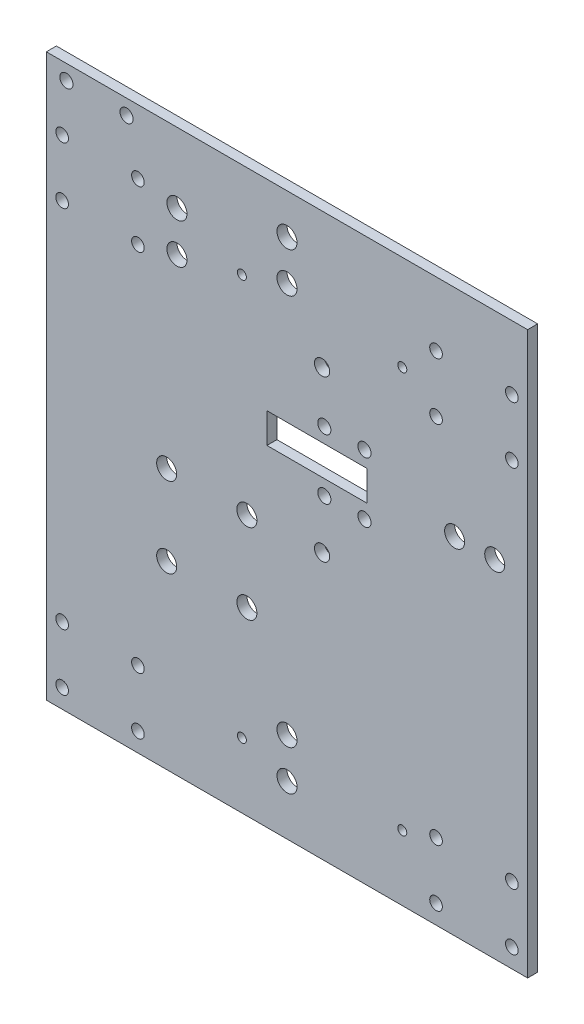
from build123d import *

# Parameters (mm, degrees)
SKETCH1_W           = 152.4
SKETCH1_H           = 177.8
SKETCH1_R           = 3.175
SKETCH1_R_2         = 2.0828
SKETCH1_R_3         = 2
SKETCH1_R_4         = 2.413
SKETCH1_R_5         = 1.4224
SKETCH1_W_2         = 31.75
SKETCH1_H_2         = 9.525
BOSS_EXTRUDE1_DEPTH = 3.175


with BuildPart() as part:
    # Sketch1 → Boss-Extrude1 (new body)
    with BuildSketch(Plane.XY):
        with Locations((76.2, 88.9)):
            Rectangle(SKETCH1_W, SKETCH1_H)
        with Locations((38.1, 82.55)):
            Circle(SKETCH1_R, mode=Mode.SUBTRACT)
        with Locations((63.5, 82.55)):
            Circle(SKETCH1_R, mode=Mode.SUBTRACT)
        with Locations((38.1, 57.15)):
            Circle(SKETCH1_R, mode=Mode.SUBTRACT)
        with Locations((63.5, 57.15)):
            Circle(SKETCH1_R, mode=Mode.SUBTRACT)
        with Locations((88.0237, 100.0125)):
            Circle(SKETCH1_R_2, mode=Mode.SUBTRACT)
        with Locations((100.7237, 100.0125)):
            Circle(SKETCH1_R_2, mode=Mode.SUBTRACT)
        with Locations((88.0237, 119.0625)):
            Circle(SKETCH1_R_2, mode=Mode.SUBTRACT)
        with Locations((100.7237, 119.0625)):
            Circle(SKETCH1_R_2, mode=Mode.SUBTRACT)
        with Locations((129.286, 109.5375)):
            Circle(SKETCH1_R, mode=Mode.SUBTRACT)
        with Locations((123.4, 139.48)):
            Circle(SKETCH1_R_3, mode=Mode.SUBTRACT)
        with Locations((147.4, 139.48)):
            Circle(SKETCH1_R_3, mode=Mode.SUBTRACT)
        with Locations((123.4, 157.48)):
            Circle(SKETCH1_R_3, mode=Mode.SUBTRACT)
        with Locations((147.4, 157.48)):
            Circle(SKETCH1_R_3, mode=Mode.SUBTRACT)
        with Locations((5, 6)):
            Circle(SKETCH1_R_3, mode=Mode.SUBTRACT)
        with Locations((29, 6)):
            Circle(SKETCH1_R_3, mode=Mode.SUBTRACT)
        with Locations((5, 24)):
            Circle(SKETCH1_R_3, mode=Mode.SUBTRACT)
        with Locations((29, 24)):
            Circle(SKETCH1_R_3, mode=Mode.SUBTRACT)
        with Locations((5, 139.48)):
            Circle(SKETCH1_R_3, mode=Mode.SUBTRACT)
        with Locations((29, 139.48)):
            Circle(SKETCH1_R_3, mode=Mode.SUBTRACT)
        with Locations((5, 157.48)):
            Circle(SKETCH1_R_3, mode=Mode.SUBTRACT)
        with Locations((29, 157.48)):
            Circle(SKETCH1_R_3, mode=Mode.SUBTRACT)
        with Locations((123.4, 6)):
            Circle(SKETCH1_R_3, mode=Mode.SUBTRACT)
        with Locations((147.4, 6)):
            Circle(SKETCH1_R_3, mode=Mode.SUBTRACT)
        with Locations((123.4, 24)):
            Circle(SKETCH1_R_3, mode=Mode.SUBTRACT)
        with Locations((147.4, 24)):
            Circle(SKETCH1_R_3, mode=Mode.SUBTRACT)
        with Locations((41.35, 155.575)):
            Circle(SKETCH1_R, mode=Mode.SUBTRACT)
        with Locations((41.35, 142.875)):
            Circle(SKETCH1_R, mode=Mode.SUBTRACT)
        with Locations((6.35, 173.0375)):
            Circle(SKETCH1_R_2, mode=Mode.SUBTRACT)
        with Locations((25.4, 173.0375)):
            Circle(SKETCH1_R_2, mode=Mode.SUBTRACT)
        with Locations((141.986, 109.5375)):
            Circle(SKETCH1_R, mode=Mode.SUBTRACT)
        with Locations((87.3125, 84.1375)):
            Circle(SKETCH1_R_4, mode=Mode.SUBTRACT)
        with Locations((87.3125, 134.9375)):
            Circle(SKETCH1_R_4, mode=Mode.SUBTRACT)
        with Locations((61.9125, 147.6375)):
            Circle(SKETCH1_R_5, mode=Mode.SUBTRACT)
        with Locations((112.7125, 147.6375)):
            Circle(SKETCH1_R_5, mode=Mode.SUBTRACT)
        with Locations((112.7125, 20.6375)):
            Circle(SKETCH1_R_5, mode=Mode.SUBTRACT)
        with Locations((61.9125, 20.6375)):
            Circle(SKETCH1_R_5, mode=Mode.SUBTRACT)
        with Locations((76.2, 28.575)):
            Circle(SKETCH1_R, mode=Mode.SUBTRACT)
        with Locations((76.2, 15.875)):
            Circle(SKETCH1_R, mode=Mode.SUBTRACT)
        with Locations((76.2, 165.1)):
            Circle(SKETCH1_R, mode=Mode.SUBTRACT)
        with Locations((76.2, 152.4)):
            Circle(SKETCH1_R, mode=Mode.SUBTRACT)
        with Locations((85.725, 109.5375)):
            Rectangle(SKETCH1_W_2, SKETCH1_H_2, mode=Mode.SUBTRACT)
    extrude(amount=BOSS_EXTRUDE1_DEPTH)


solid = part.part
